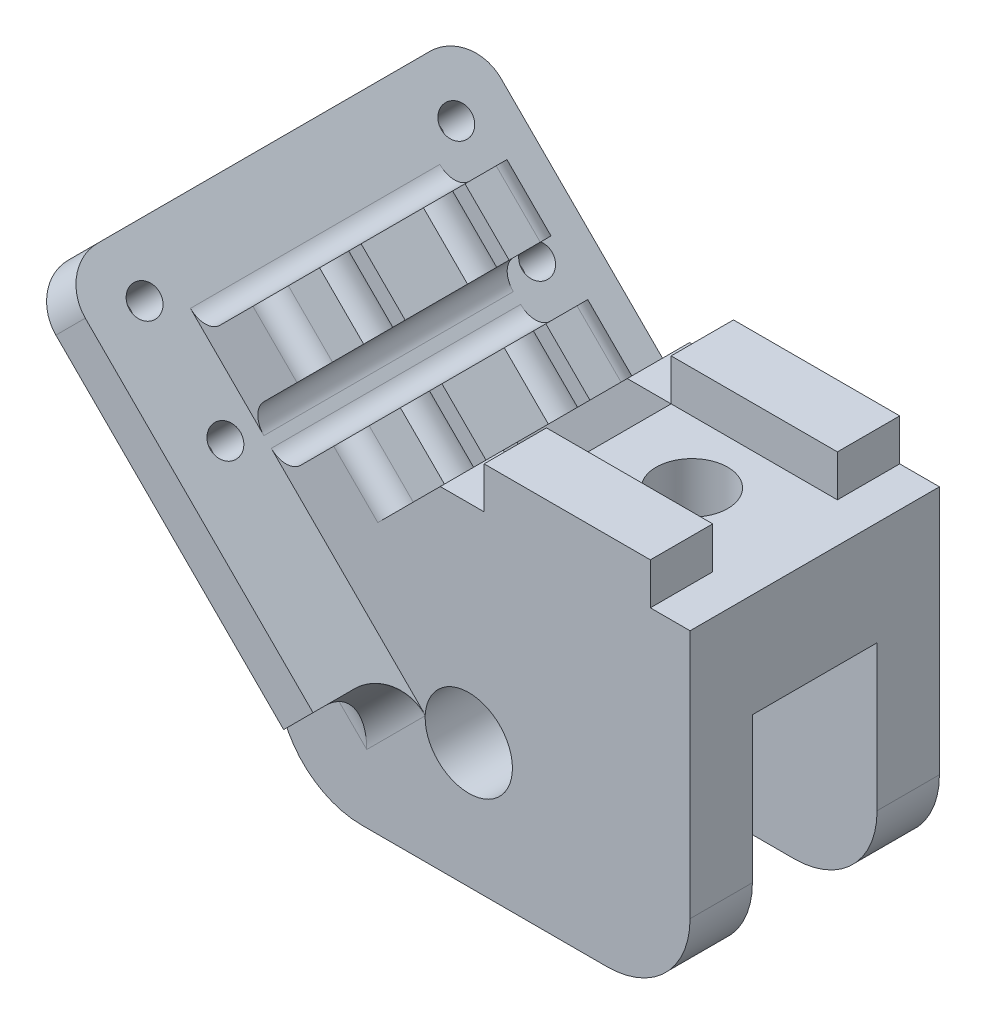
from build123d import *
from build123d.topology import SkipClean

# Parameters (mm, degrees)
SKETCH1_R                        = 2.1
FINGER_BASE_1_DEPTH              = 6
SKETCH2_W                        = 20
SKETCH2_H                        = 2
FLEXURE_JOINT_BASE_DEPTH         = 13
SKETCH3_W                        = 8
SKETCH3_H                        = 2
PULLEY_HOUSING_DEPTH             = 3
M3_NUT_DEPTH                     = 2
SKETCH5_R                        = 1.725
M3_HOLE_DEPTH                    = 3
SKETCH9_W                        = 4
SKETCH9_H                        = 2
SUPPORT_FLEXURE_JOINT_BASE_DEPTH = 4.5
SKETCH10_R                       = 0.725
HOLE_FOR_STICHING_DEPTH          = 23.216728933
SKETCH11_W                       = 3
SKETCH11_H                       = 12
TUBE_PLATE_DEPTH                 = 4.25
TUBE_HOUSING_REACH               = 35.132
FINGER_BASE_CONTOURING_R         = 1
FINGER_BASE_CONTOURING_R_2       = 2
FINGER_BASE_CONTOURING_R_3       = 4


with BuildPart() as part:
    # Sketch1 → Finger Base 1 (new, symmetric)
    with BuildSketch(Plane.XY):
        Polygon((0, 8.221825407), (7.778174593, 16), (9.889087297, 16), (9.889087297, 18), (17.889087297, 18), (17.889087297, 16), (19.8, 16), (19.8, 0), (0, 0), align=None)
        with Locations((9.151471863, 6)):
            Circle(SKETCH1_R, mode=Mode.SUBTRACT)
    extrude(amount=FINGER_BASE_1_DEPTH, both=True)

    # Sketch2 → Flexure Joint Base (add)
    with BuildSketch(Plane(origin=(-4.110912703, 4.110912703, 0), x_dir=(0, 0, 1), z_dir=(-0.7071067811865462, 0.707106781186549, 0))):
        with Locations((0, 8.313708499)):
            Rectangle(SKETCH2_W, SKETCH2_H)
    extrude(amount=FLEXURE_JOINT_BASE_DEPTH)

    # Sketch3 → Pulley Housing (cut, symmetric)
    with SkipClean():  # the faces are left unmerged after this step: merging them gives an invalid solid
        with BuildSketch(Plane.XY):
            with BuildLine():
                ThreePointArc((7.054725188, 6.116847687), (7.62579494, 4.556978889), (9.151471863, 3.9))
                Line((9.151471863, 3.9), (9.151471863, 0))
                Line((9.151471863, 0), (19.8, 0))
                Line((19.8, 0), (19.8, 11))
                Line((19.8, 11), (9.889087297, 11))
                Line((9.889087297, 11), (9.889087297, 16))
                Line((9.889087297, 16), (7.778174593, 16))
                Line((7.778174593, 16), (2.474873734, 10.696699141))
                Line((2.474873734, 10.696699141), (7.054725188, 6.116847687))
            make_face()
            with Locations((13.889087297, 17)):
                Rectangle(SKETCH3_W, SKETCH3_H)
        extrude(amount=PULLEY_HOUSING_DEPTH, both=True, mode=Mode.SUBTRACT)
    add(part.part.scale(1), mode=Mode.REPLACE)  # the faces are merged on a copy

    # Sketch4 → M3 Nut (cut)
    with BuildSketch(Plane.XZ.offset(-11)):
        Polygon((10.598190762, 0), (12.243639029, -2.85), (15.534535564, -2.85), (17.179983831, 0), (15.534535564, 2.85), (12.243639029, 2.85), align=None)
    extrude(amount=-M3_NUT_DEPTH, mode=Mode.SUBTRACT)

    # Sketch5 → M3 Hole (cut)
    with BuildSketch(Plane.XZ.offset(-13)):
        with Locations(Location((13.889087297, 0, 0), (0, 0, 270))):
            Circle(SKETCH5_R)
    extrude(amount=-M3_HOLE_DEPTH, mode=Mode.SUBTRACT)

    # Sketch9 → Support Flexure Joint Base (add)
    with BuildSketch(Plane(origin=(-4.110912703, 4.110912703, 0), x_dir=(0, 0, -1), z_dir=(0.7071067811865462, -0.7071067811865488, 0))):
        with Locations((-8, 8.313708499)):
            Rectangle(SKETCH9_W, SKETCH9_H)
        with Locations((8, 8.313708499)):
            Rectangle(SKETCH9_W, SKETCH9_H)
    extrude(amount=SUPPORT_FLEXURE_JOINT_BASE_DEPTH)

    # Sketch10 → Hole For Stiching (cut, through all)
    with BuildSketch(Plane(origin=(6.585786438, 6.585786438, 0), x_dir=(0.7071067811865462, -0.707106781186549, 0), z_dir=(0.707106781186549, 0.7071067811865462, 0))):
        with Locations(Location((-16.313708499, -7.5, 0), (0, 0, 180))):
            Circle(SKETCH10_R)
        with Locations(Location((-10.813708499, -7.5, 0), (0, 0, 180))):
            Circle(SKETCH10_R)
        with Locations(Location((-10.813708499, 7.5, 0), (0, 0, 180))):
            Circle(SKETCH10_R)
        with Locations(Location((-16.313708499, 7.5, 0), (0, 0, 180))):
            Circle(SKETCH10_R)
    extrude(amount=-HOLE_FOR_STICHING_DEPTH, mode=Mode.SUBTRACT)

    # Sketch11 → Tube Plate (add)
    with BuildSketch(Plane(origin=(6.585786438, 6.585786438, 0), x_dir=(0.7071067811865462, -0.707106781186549, 0), z_dir=(0.707106781186549, 0.7071067811865462, 0))):
        with Locations((-12.813708499, 0)):
            Rectangle(SKETCH11_W, SKETCH11_H)
        with Locations((-7.313708499, 0)):
            Rectangle(SKETCH11_W, SKETCH11_H)
    extrude(amount=TUBE_PLATE_DEPTH)

    # Tube Housing: up to this face of the body (flat: up to its plane)
    tube_housing_end = Plane(part.part.faces().sort_by_distance((3.977475644, 12.199301051, 0))[0])
    # Sketch12 → Tube Housing (cut, up to the picked face)
    with BuildSketch(Plane(origin=(-10.121320344, 10.121320344, 0), x_dir=(0, 0, 1), z_dir=(-0.7071067811865462, 0.707106781186549, 0)), mode=Mode.PRIVATE) as tube_housing_sk1:
        with BuildLine():
            Line((-3.5, 13.563708499), (-1.5, 13.563708499))
            Line((-1.5, 13.563708499), (-1.5, 12.720626356))
            ThreePointArc((-1.5, 12.720626356), (-2.5, 10.463708499), (-3.5, 12.720626356))
            Line((-3.5, 12.720626356), (-3.5, 13.563708499))
        make_face()
    tube_housing_tool1 = split(extrude(tube_housing_sk1.sketch, amount=-TUBE_HOUSING_REACH, mode=Mode.PRIVATE), bisect_by=tube_housing_end, keep=Keep.BOTH, mode=Mode.PRIVATE)
    # Sketch12 → Tube Housing (cut, up to the picked face)
    with BuildSketch(Plane(origin=(-10.121320344, 10.121320344, 0), x_dir=(0, 0, 1), z_dir=(-0.7071067811865462, 0.707106781186549, 0)), mode=Mode.PRIVATE) as tube_housing_sk2:
        with BuildLine():
            Line((1.5, 12.720626356), (1.5, 13.563708499))
            Line((1.5, 13.563708499), (3.5, 13.563708499))
            Line((3.5, 13.563708499), (3.5, 12.720626356))
            ThreePointArc((3.5, 12.720626356), (2.5, 10.463708499), (1.5, 12.720626356))
        make_face()
    tube_housing_tool2 = split(extrude(tube_housing_sk2.sketch, amount=-TUBE_HOUSING_REACH, mode=Mode.PRIVATE), bisect_by=tube_housing_end, keep=Keep.BOTH, mode=Mode.PRIVATE)
    add(tube_housing_tool1.solids().sort_by(Axis((-1.604122, 18.638518, -2.5), (0.7071067811865462, -0.707106781186549, 0)))[0], mode=Mode.SUBTRACT)
    add(tube_housing_tool2.solids().sort_by(Axis((-1.604122, 18.638518, 2.5), (0.7071067811865462, -0.707106781186549, 0)))[0], mode=Mode.SUBTRACT)

    # Finger Base Contouring
    # the kernel refuses this fillet: 4, 2, 1 mm, written as the material it adds along each edge
    with BuildSketch(Plane(origin=(-1.414213562, 14.585786438, 6), x_dir=(0.7071067811865426, -0.7071067811865525, 0), z_dir=(0, 0, -1)), Plane(origin=(-3.535533906, 16.707106781, -6), x_dir=(-0.7071067811865498, 0.7071067811865454, 0), z_dir=(0, 0, 1))) as finger_base_contouring_piece_1:
        with BuildLine():
            CenterArc((FINGER_BASE_CONTOURING_R, -FINGER_BASE_CONTOURING_R), FINGER_BASE_CONTOURING_R, 90, 90)
            Line((0, -FINGER_BASE_CONTOURING_R), (0, 0))
            Line((0, 0), (FINGER_BASE_CONTOURING_R, 0))
        make_face()
    extrude(amount=12)
    with BuildSketch(Plane(origin=(0.353553391, 12.818019485, -6), x_dir=(0.7071067811865487, 0.7071067811865465, 0), z_dir=(0, 0, 1))) as finger_base_contouring_piece_2:
        with BuildLine():
            CenterArc((FINGER_BASE_CONTOURING_R, FINGER_BASE_CONTOURING_R), FINGER_BASE_CONTOURING_R, 180, 90)
            Line((0, FINGER_BASE_CONTOURING_R), (0, 0))
            Line((0, 0), (FINGER_BASE_CONTOURING_R, 0))
        make_face()
    extrude(amount=12)
    with BuildSketch(Plane(origin=(1.060660172, 9.282485579, 6), x_dir=(0, 0, 1), z_dir=(0.7071067811865462, -0.7071067811865488, 0))) as finger_base_contouring_piece_3_section:
        with BuildLine():
            CenterArc((FINGER_BASE_CONTOURING_R_2, FINGER_BASE_CONTOURING_R_2), FINGER_BASE_CONTOURING_R_2, 180, 90)
            Line((0, FINGER_BASE_CONTOURING_R_2), (0, 0))
            Line((0, 0), (FINGER_BASE_CONTOURING_R_2, 0))
        make_face()
    finger_base_contouring_piece_3 = extrude(amount=4.5, mode=Mode.PRIVATE)
    finger_base_contouring_piece_3 = split(finger_base_contouring_piece_3, bisect_by=Plane(origin=(0, 9.282485579, 6), z_dir=(1, 0, 0)), keep=Keep.TOP, mode=Mode.PRIVATE)
    add(finger_base_contouring_piece_3)
    with BuildSketch(Plane(origin=(5.656854249, 7.514718626, 6), x_dir=(0, 0, 1), z_dir=(-0.7071067811865488, -0.7071067811865462, 0))) as finger_base_contouring_piece_4_section:
        with BuildLine():
            CenterArc((FINGER_BASE_CONTOURING_R_2, -FINGER_BASE_CONTOURING_R_2), FINGER_BASE_CONTOURING_R_2, 90, 90)
            Line((0, -FINGER_BASE_CONTOURING_R_2), (0, 0))
            Line((0, 0), (FINGER_BASE_CONTOURING_R_2, 0))
        make_face()
    finger_base_contouring_piece_4 = extrude(amount=2, mode=Mode.PRIVATE)
    finger_base_contouring_piece_4 = finger_base_contouring_piece_4 - Plane(origin=(9.151471863, 6, 6), x_dir=(1, 0, 0), z_dir=(0, 0, -1)) * Cylinder(2.1, 12, mode=Mode.PRIVATE)
    add(finger_base_contouring_piece_4)
    with BuildSketch(Plane(origin=(1.060660172, 9.282485579, -6), x_dir=(-0.7071067811865489, -0.7071067811865462, 0), z_dir=(0.7071067811865462, -0.7071067811865488, 0))) as finger_base_contouring_piece_5_section:
        with BuildLine():
            CenterArc((FINGER_BASE_CONTOURING_R_2, FINGER_BASE_CONTOURING_R_2), FINGER_BASE_CONTOURING_R_2, 180, 90)
            Line((0, FINGER_BASE_CONTOURING_R_2), (0, 0))
            Line((0, 0), (FINGER_BASE_CONTOURING_R_2, 0))
        make_face()
    finger_base_contouring_piece_5 = extrude(amount=4.5, mode=Mode.PRIVATE)
    finger_base_contouring_piece_5 = split(finger_base_contouring_piece_5, bisect_by=Plane(origin=(0, 9.282485579, -6), z_dir=(1, 0, 0)), keep=Keep.TOP, mode=Mode.PRIVATE)
    add(finger_base_contouring_piece_5)
    with BuildSketch(Plane(origin=(4.242640687, 6.100505063, -6), x_dir=(0.7071067811865464, -0.7071067811865488, 0), z_dir=(0.7071067811865488, 0.7071067811865462, 0))) as finger_base_contouring_piece_6_section:
        with BuildLine():
            CenterArc((FINGER_BASE_CONTOURING_R_2, FINGER_BASE_CONTOURING_R_2), FINGER_BASE_CONTOURING_R_2, 180, 90)
            Line((0, FINGER_BASE_CONTOURING_R_2), (0, 0))
            Line((0, 0), (FINGER_BASE_CONTOURING_R_2, 0))
        make_face()
    finger_base_contouring_piece_6 = extrude(amount=2, mode=Mode.PRIVATE)
    finger_base_contouring_piece_6 = finger_base_contouring_piece_6 - Plane(origin=(9.151471863, 6, -6), x_dir=(1, 0, 0), z_dir=(0, 0, -1)) * Cylinder(2.1, 13, mode=Mode.PRIVATE)
    add(finger_base_contouring_piece_6)
    with BuildSketch(Plane(origin=(5.656854249, 7.514718626, 6), x_dir=(0, 0, 1), z_dir=(-0.7071067811865488, -0.7071067811865462, 0))) as finger_base_contouring_piece_7a_section:
        with BuildLine():
            CenterArc((FINGER_BASE_CONTOURING_R_2, -FINGER_BASE_CONTOURING_R_2), FINGER_BASE_CONTOURING_R_2, 90, 90)
            Line((0, -FINGER_BASE_CONTOURING_R_2), (0, 0))
            Line((0, 0), (FINGER_BASE_CONTOURING_R_2, 0))
        make_face()
    finger_base_contouring_piece_7a = extrude(amount=7, mode=Mode.PRIVATE)
    finger_base_contouring_piece_7a = split(finger_base_contouring_piece_7a, bisect_by=Plane(origin=(4.242640687, 6.100505063, 6), z_dir=(-0.7071067811865489, -0.7071067811865461, 0)), keep=Keep.TOP, mode=Mode.PRIVATE)
    with BuildSketch(Plane(origin=(1.060660172, 9.282485579, 6), x_dir=(0, 0, 1), z_dir=(0.7071067811865462, -0.7071067811865488, 0))) as finger_base_contouring_piece_7b_section:
        with BuildLine():
            CenterArc((FINGER_BASE_CONTOURING_R_2, FINGER_BASE_CONTOURING_R_2), FINGER_BASE_CONTOURING_R_2, 180, 90)
            Line((0, FINGER_BASE_CONTOURING_R_2), (0, 0))
            Line((0, 0), (FINGER_BASE_CONTOURING_R_2, 0))
        make_face()
    finger_base_contouring_piece_7b = extrude(amount=9.5, mode=Mode.PRIVATE)
    finger_base_contouring_piece_7b = split(finger_base_contouring_piece_7b, bisect_by=Plane(origin=(4.242640687, 6.100505063, 6), z_dir=(0.7071067811865462, -0.7071067811865488, 0)), keep=Keep.TOP, mode=Mode.PRIVATE)
    finger_base_contouring_piece_7 = finger_base_contouring_piece_7a & finger_base_contouring_piece_7b
    add(finger_base_contouring_piece_7)
    with BuildSketch(Plane(origin=(1.060660172, 9.282485579, -6), x_dir=(-0.7071067811865489, -0.7071067811865462, 0), z_dir=(0.7071067811865462, -0.7071067811865488, 0))) as finger_base_contouring_piece_8a_section:
        with BuildLine():
            CenterArc((FINGER_BASE_CONTOURING_R_2, FINGER_BASE_CONTOURING_R_2), FINGER_BASE_CONTOURING_R_2, 180, 90)
            Line((0, FINGER_BASE_CONTOURING_R_2), (0, 0))
            Line((0, 0), (FINGER_BASE_CONTOURING_R_2, 0))
        make_face()
    finger_base_contouring_piece_8a = extrude(amount=9.5, mode=Mode.PRIVATE)
    finger_base_contouring_piece_8a = split(finger_base_contouring_piece_8a, bisect_by=Plane(origin=(4.242640687, 6.100505063, -6), z_dir=(0.7071067811865462, -0.7071067811865488, 0)), keep=Keep.TOP, mode=Mode.PRIVATE)
    with BuildSketch(Plane(origin=(0.707106781, 2.564971157, -6), x_dir=(0.7071067811865464, -0.7071067811865488, 0), z_dir=(0.7071067811865488, 0.7071067811865462, 0))) as finger_base_contouring_piece_8b_section:
        with BuildLine():
            CenterArc((FINGER_BASE_CONTOURING_R_2, FINGER_BASE_CONTOURING_R_2), FINGER_BASE_CONTOURING_R_2, 180, 90)
            Line((0, FINGER_BASE_CONTOURING_R_2), (0, 0))
            Line((0, 0), (FINGER_BASE_CONTOURING_R_2, 0))
        make_face()
    finger_base_contouring_piece_8b = extrude(amount=7, mode=Mode.PRIVATE)
    finger_base_contouring_piece_8b = split(finger_base_contouring_piece_8b, bisect_by=Plane(origin=(4.242640687, 6.100505063, -6), z_dir=(-0.7071067811865489, -0.7071067811865461, 0)), keep=Keep.TOP, mode=Mode.PRIVATE)
    finger_base_contouring_piece_8 = finger_base_contouring_piece_8a & finger_base_contouring_piece_8b
    add(finger_base_contouring_piece_8)
    # the kernel refuses this fillet: 4, 2, 1 mm, written as the material it takes off along each edge
    with BuildSketch(Plane(origin=(3.358757211, 15.823223305, -6), x_dir=(0, 0, 1), z_dir=(-0.7071067811865462, 0.707106781186549, 0))) as finger_base_contouring_2_piece_1:
        with BuildLine():
            CenterArc((FINGER_BASE_CONTOURING_R, -FINGER_BASE_CONTOURING_R), FINGER_BASE_CONTOURING_R, 90, 90)
            Line((0, -FINGER_BASE_CONTOURING_R), (0, 0))
            Line((0, 0), (FINGER_BASE_CONTOURING_R, 0))
        make_face()
    extrude(amount=8, mode=Mode.SUBTRACT)
    with BuildSketch(Plane(origin=(-2.298097039, 21.480077554, 6), x_dir=(-0.707106781186549, -0.7071067811865461, 0), z_dir=(0.7071067811865462, -0.707106781186549, 0))) as finger_base_contouring_2_piece_2:
        with BuildLine():
            CenterArc((FINGER_BASE_CONTOURING_R, FINGER_BASE_CONTOURING_R), FINGER_BASE_CONTOURING_R, 180, 90)
            Line((0, FINGER_BASE_CONTOURING_R), (0, 0))
            Line((0, 0), (FINGER_BASE_CONTOURING_R, 0))
        make_face()
    extrude(amount=8, mode=Mode.SUBTRACT)
    with BuildSketch(Plane(origin=(5.480077554, 13.701902961, -6), x_dir=(-0.7071067811865489, -0.7071067811865462, -1.776356839400251e-15), z_dir=(-0.7071067811865462, 0.707106781186549, 0)), Plane(origin=(1.590990258, 17.590990258, 6), x_dir=(-0.7071067811865489, -0.7071067811865462, -1.776356839400251e-15), z_dir=(0.7071067811865462, -0.707106781186549, 0))) as finger_base_contouring_2_piece_3:
        with BuildLine():
            CenterArc((FINGER_BASE_CONTOURING_R, FINGER_BASE_CONTOURING_R), FINGER_BASE_CONTOURING_R, 180, 90)
            Line((0, FINGER_BASE_CONTOURING_R), (0, 0))
            Line((0, 0), (FINGER_BASE_CONTOURING_R, 0))
        make_face()
    extrude(amount=5.5, mode=Mode.SUBTRACT)
    with BuildSketch(Plane(origin=(-3.181980515, 23.424621202, 10), x_dir=(0, 0, -1), z_dir=(-0.707106781186549, -0.7071067811865462, -1.7763568394002497e-15))) as finger_base_contouring_2_piece_4:
        with BuildLine():
            CenterArc((FINGER_BASE_CONTOURING_R_2, FINGER_BASE_CONTOURING_R_2), FINGER_BASE_CONTOURING_R_2, 180, 90)
            Line((0, FINGER_BASE_CONTOURING_R_2), (0, 0))
            Line((0, 0), (FINGER_BASE_CONTOURING_R_2, 0))
        make_face()
    extrude(amount=12, mode=Mode.SUBTRACT)
    with BuildSketch(Plane(origin=(-11.66726189, 14.939339828, -10), x_dir=(0.707106781186546, -0.7071067811865489, 0), z_dir=(0.707106781186549, 0.7071067811865462, 0))) as finger_base_contouring_2_piece_5:
        with BuildLine():
            CenterArc((FINGER_BASE_CONTOURING_R_2, -FINGER_BASE_CONTOURING_R_2), FINGER_BASE_CONTOURING_R_2, 90, 90)
            Line((0, -FINGER_BASE_CONTOURING_R_2), (0, 0))
            Line((0, 0), (FINGER_BASE_CONTOURING_R_2, 0))
        make_face()
    extrude(amount=12, mode=Mode.SUBTRACT)
    with BuildSketch(Plane(origin=(0, 0, -16), x_dir=(1, 0, 0), z_dir=(0, 0, 1))) as finger_base_contouring_2_piece_6:
        with BuildLine():
            CenterArc((FINGER_BASE_CONTOURING_R_3, FINGER_BASE_CONTOURING_R_3), FINGER_BASE_CONTOURING_R_3, 180, 90)
            Line((0, FINGER_BASE_CONTOURING_R_3), (0, 0))
            Line((0, 0), (FINGER_BASE_CONTOURING_R_3, 0))
        make_face()
    extrude(amount=32, mode=Mode.SUBTRACT)
    with BuildSketch(Plane(origin=(19.8, 0, -7), x_dir=(0, 1, 0), z_dir=(0, 0, 1)), Plane(origin=(19.8, 0, -16), x_dir=(0, 1, 0), z_dir=(0, 0, 1))) as finger_base_contouring_2_piece_7:
        with BuildLine():
            CenterArc((FINGER_BASE_CONTOURING_R_3, FINGER_BASE_CONTOURING_R_3), FINGER_BASE_CONTOURING_R_3, 180, 90)
            Line((0, FINGER_BASE_CONTOURING_R_3), (0, 0))
            Line((0, 0), (FINGER_BASE_CONTOURING_R_3, 0))
        make_face()
    extrude(amount=23, mode=Mode.SUBTRACT)


solid = part.part
